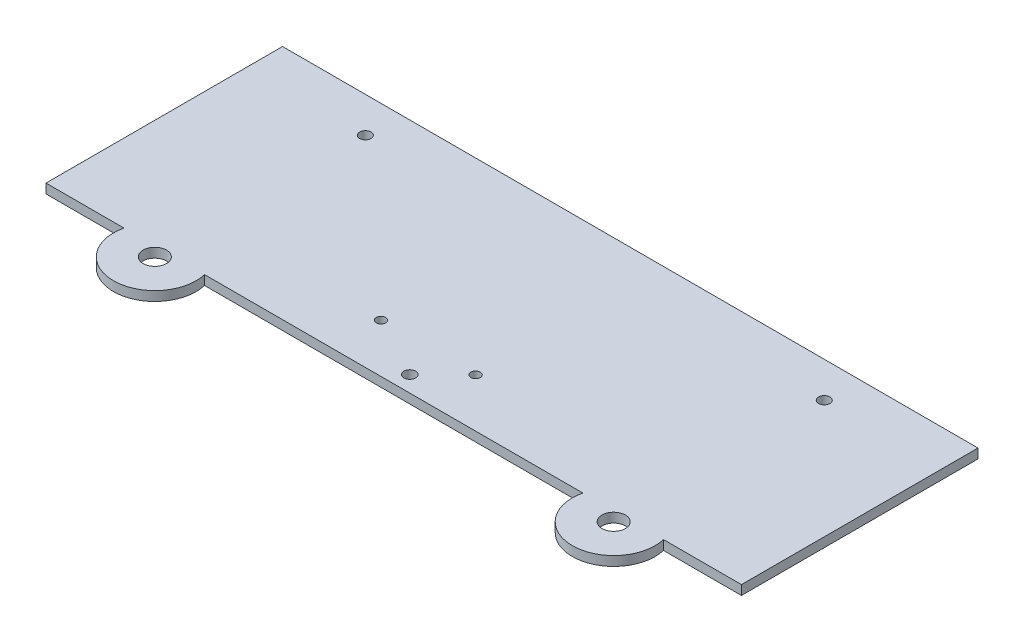
from build123d import *

# Parameters (mm, degrees)
BOSS_EXTRUDE1_DEPTH     = 5.07492
SKETCH1_5_R             = 6.2865
CUT_EXTRUDE1_DEPTH      = 208.664293845
CUT_EXTRUDE2_DEPTH      = 208.664293845
CUT_EXTRUDE2_DEPTH_BACK = 208.664293845
SKETCH1_7_R             = 3.048
SKETCH1_8_R             = 2.54
SKETCH1_8_R_2           = 3.175
CUT_EXTRUDE3_DEPTH      = 208.664293845


with BuildPart() as part:
    # Sketch1 → Boss-Extrude1 (new body)
    with BuildSketch(Plane(origin=(0, 0, 0), x_dir=(1, 0, 0), z_dir=(0, 1, 0))):
        with BuildLine():
            Line((-186.69, 63.5), (-186.69, -63.5))
            Line((-186.69, -63.5), (-144.826640797, -63.5))
            ThreePointArc((-144.826640797, -63.5), (-123.19, -90.805), (-101.553359203, -63.5))
            Line((-101.553359203, -63.5), (101.553359203, -63.5))
            ThreePointArc((101.553359203, -63.5), (123.19, -90.805), (144.826640797, -63.5))
            Line((144.826640797, -63.5), (186.69, -63.5))
            Line((186.69, -63.5), (186.69, 63.5))
            Line((186.69, 63.5), (-186.69, 63.5))
        make_face()
    extrude(amount=BOSS_EXTRUDE1_DEPTH)

    # Sketch1<5> → Cut-Extrude1 (cut, through all)
    with BuildSketch(Plane(origin=(0, 0, 0), x_dir=(1, 0, 0), z_dir=(0, 1, 0))):
        with Locations((-123.19, -68.58)):
            Circle(SKETCH1_5_R)
        with Locations((123.19, -68.58)):
            Circle(SKETCH1_5_R)
    extrude(amount=CUT_EXTRUDE1_DEPTH, mode=Mode.SUBTRACT)

    # Sketch1<7> → Cut-Extrude2 (cut, two sides: drawn at the far end of the back side and taken through both)
    with BuildSketch(Plane(origin=(0, 0, 0), x_dir=(1, 0, 0), z_dir=(0, 1, 0)).offset(-CUT_EXTRUDE2_DEPTH_BACK)):
        with Locations((-123.19, 44.45)):
            Circle(SKETCH1_7_R)
        with Locations((123.19, 44.45)):
            Circle(SKETCH1_7_R)
    extrude(amount=CUT_EXTRUDE2_DEPTH + CUT_EXTRUDE2_DEPTH_BACK, mode=Mode.SUBTRACT)

    # Sketch1<8> → Cut-Extrude3 (cut, through all)
    with BuildSketch(Plane(origin=(0, 0, 0), x_dir=(1, 0, 0), z_dir=(0, 1, 0))):
        with Locations((-33.02, -37.338)):
            Circle(SKETCH1_8_R)
        with Locations((17.78, -37.338)):
            Circle(SKETCH1_8_R)
        with Locations((0, -54.864)):
            Circle(SKETCH1_8_R_2)
    extrude(amount=CUT_EXTRUDE3_DEPTH, mode=Mode.SUBTRACT)


solid = part.part
